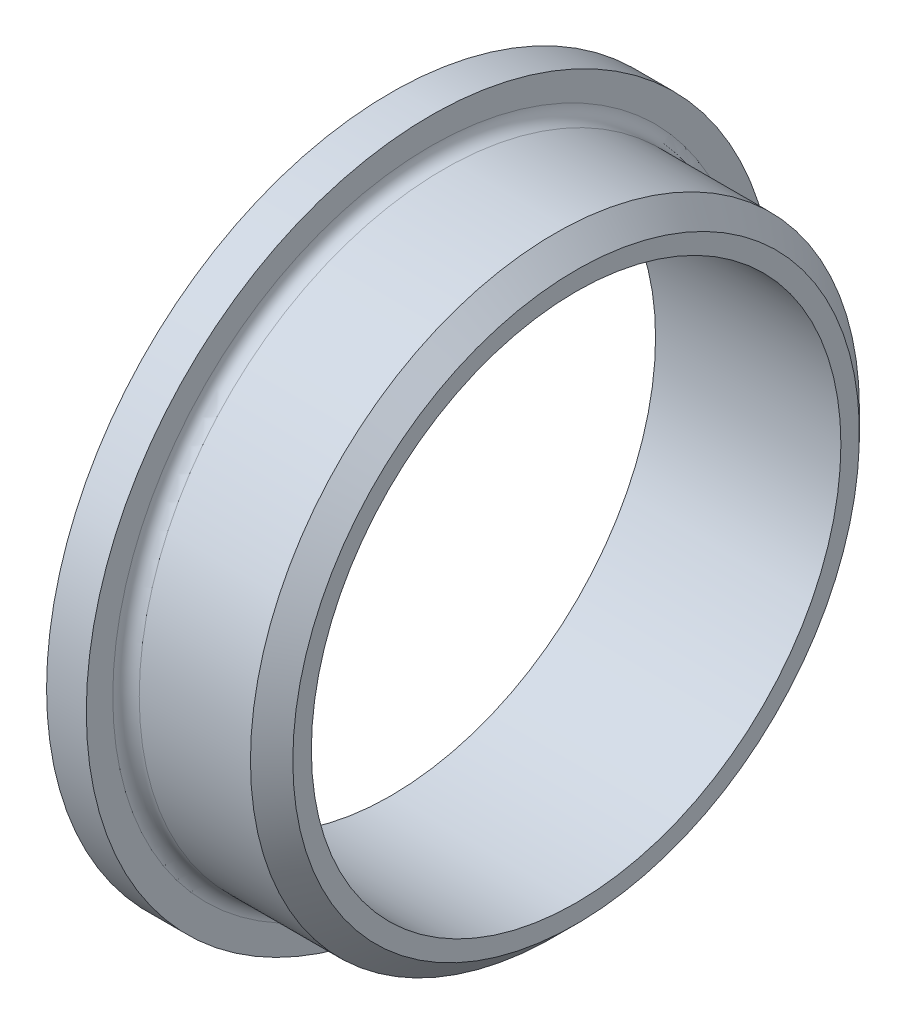
from build123d import *

# Parameters (mm, degrees)
FILLET1_R     = 0.5
CHAMFER1_SIZE = 0.8


with BuildPart() as part:
    # Sketch1 → Revolve1 (revolve)
    with BuildSketch(Plane.XY):
        Polygon((7, 10), (0, 10), (0, 13), (1.5, 13), (1.5, 11.5), (7, 11.5), align=None)
    revolve(axis=Axis((0, 0, 0), (1, 0, 0)))

    # Fillet1
    fillet1_edges = [part.edges().sort_by_distance(p)[0] for p in [
        (1.5, -11.5, 0),
    ]]
    fillet(fillet1_edges, radius=FILLET1_R)

    # Chamfer1
    chamfer1_edges = [part.edges().sort_by_distance(p)[0] for p in [
        (7, -11.5, 0),
    ]]
    chamfer(chamfer1_edges, length=CHAMFER1_SIZE)


solid = part.part
